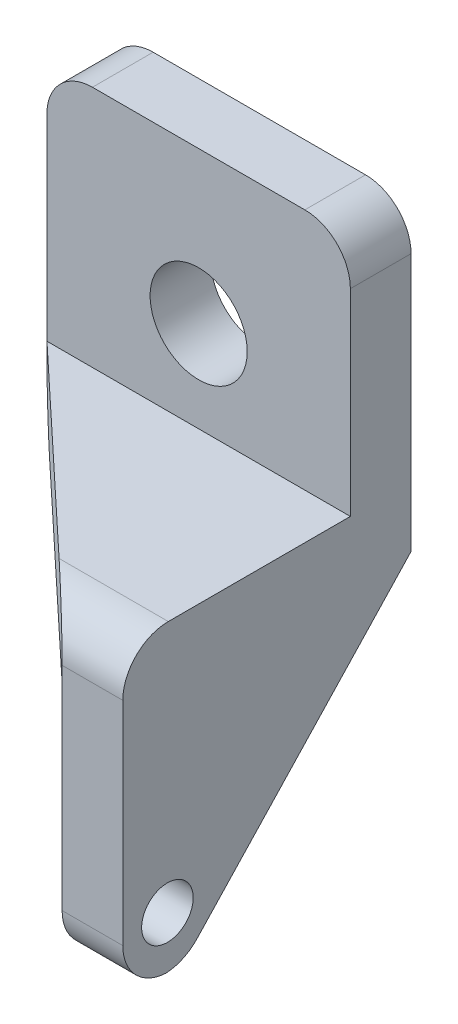
from build123d import *

# Parameters (mm, degrees)
SKETCH1_W           = 20
SKETCH1_H           = 20
SKETCH1_R           = 3.2
BOSS_EXTRUDE1_DEPTH = 4
SKETCH2_W           = 20
SKETCH2_H           = 4
BOSS_EXTRUDE2_DEPTH = 15
CUT_EXTRUDE1_DEPTH  = 15
BOSS_EXTRUDE3_DEPTH = 4
SKETCH5_R           = 1.7
CUT_EXTRUDE2_DEPTH  = 4
FILLET1_R           = 3
FILLET2_R           = 3


with BuildPart() as part:
    # Sketch1 → Boss-Extrude1 (new body)
    with BuildSketch(Plane.XY):
        Rectangle(SKETCH1_W, SKETCH1_H)
        Circle(SKETCH1_R, mode=Mode.SUBTRACT)
    extrude(amount=BOSS_EXTRUDE1_DEPTH)

    # Sketch2 → Boss-Extrude2 (add)
    with BuildSketch(Plane.XY.offset(4)):
        with Locations((0, -8)):
            Rectangle(SKETCH2_W, SKETCH2_H)
    extrude(amount=BOSS_EXTRUDE2_DEPTH)

    # Sketch3 → Cut-Extrude1 (cut)
    with BuildSketch(Plane(origin=(0, -6, 0), x_dir=(1, 0, 0), z_dir=(0, 1, 0))):
        Polygon((-10, -19), (-10, -4), (6, -19), align=None)
    extrude(amount=-CUT_EXTRUDE1_DEPTH, mode=Mode.SUBTRACT)

    # Sketch4 → Boss-Extrude3 (add)
    with BuildSketch(Plane(origin=(10, 0, 0), x_dir=(0, 0, -1), z_dir=(1, 0, 0))):
        Polygon((0, -10), (-15, -26), (-19, -26), (-19, -10), align=None)
    extrude(amount=-BOSS_EXTRUDE3_DEPTH)

    # Sketch5 → Cut-Extrude2 (cut)
    with BuildSketch(Plane(origin=(10, 0, 0), x_dir=(0, 0, -1), z_dir=(1, 0, 0))):
        with Locations((-16.059117511, -22.587455859)):
            Circle(SKETCH5_R)
    extrude(amount=-CUT_EXTRUDE2_DEPTH, mode=Mode.SUBTRACT)

    # Fillet1
    # the kernel refuses this fillet: 3 mm, written as the material it takes off along each edge
    with BuildSketch(Plane(origin=(13.249240093, -26, 15), x_dir=(0, 0.7295372041400854, -0.6839411288813294), z_dir=(-1, 0, 0))) as fillet1_piece_1:
        with BuildLine():
            CenterArc((FILLET1_R * 0.433232012466, -FILLET1_R), FILLET1_R, 90, 46.847610266)
            Line((-FILLET1_R * 0.296305191674, -FILLET1_R * 0.316058871119), (0, 0))
            Line((0, 0), (FILLET1_R * 0.433232012466, 0))
        make_face()
    extrude(amount=10.498480187, mode=Mode.SUBTRACT)
    with BuildSketch(Plane(origin=(17.5, -26, 19), x_dir=(0, 0, -1), z_dir=(-1, 0, 0))) as fillet1_piece_2:
        with BuildLine():
            CenterArc((FILLET1_R, -FILLET1_R), FILLET1_R, 90, 90)
            Line((0, -FILLET1_R), (0, 0))
            Line((0, 0), (FILLET1_R, 0))
        make_face()
    extrude(amount=19, mode=Mode.SUBTRACT)

    # Fillet2
    fillet2_edges = [part.edges().sort_by_distance(p)[0] for p in [
        (8, -6, 19),
        (-10, -10, 2),
        (-10, 10, 2),
        (10, 10, 2),
    ]]
    fillet(fillet2_edges, radius=FILLET2_R)


solid = part.part
